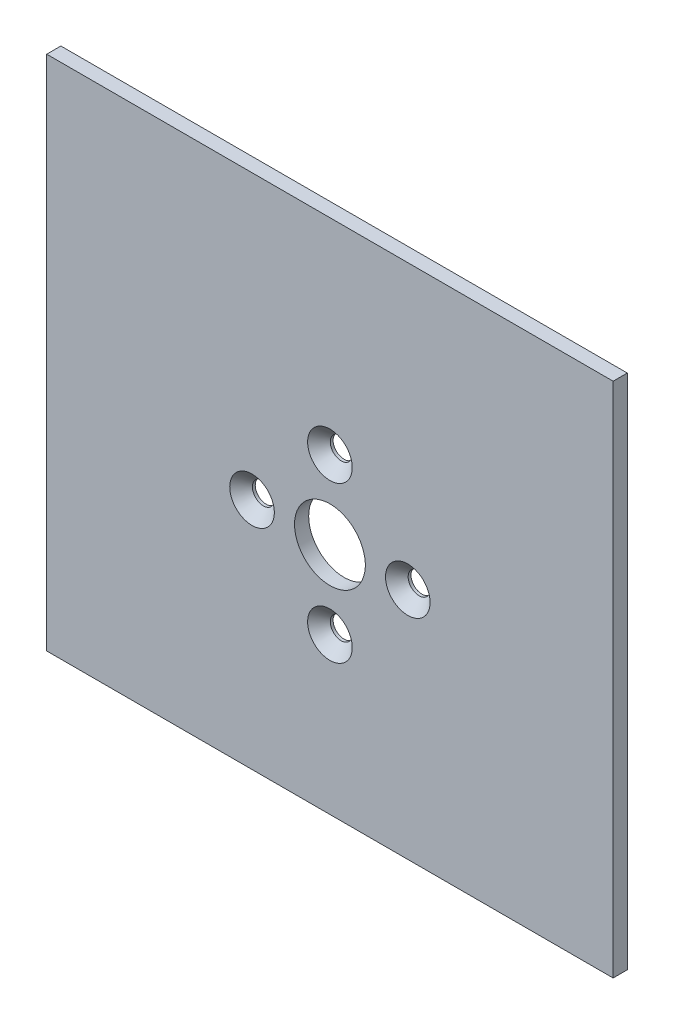
from build123d import *

# Parameters (mm, degrees)
SKETCH_1_W               = 80
SKETCH_1_H               = 73
SKETCH_1_R               = 5
EXTRUDE_1_DEPTH          = 2
PATTERN_CIRCULAR_1_COUNT = 4


with BuildPart() as part:
    # 草图1 → 凸台-拉伸1 (new body)
    with BuildSketch(Plane(origin=(0, 0, -1.3), x_dir=(-1, 0, 0), z_dir=(0, 0, -1))):
        with Locations((0, 3.5)):
            Rectangle(SKETCH_1_W, SKETCH_1_H)
        Circle(SKETCH_1_R, mode=Mode.SUBTRACT)
    extrude(amount=EXTRUDE_1_DEPTH)

    # 草图3 → 打孔尺寸(%根据十字)槽沉头自攻螺钉的类型1 (revolve, cut)
    with BuildSketch(Plane(origin=(11, 0, -1.3), x_dir=(0, -1, 0), z_dir=(1, 0, 0))):
        Polygon((0, 0), (0, 5.431333959), (1.55, 4.5), (1.55, 1.6), (3.15, 0), align=None)
    hole_wizard_1 = revolve(axis=Axis((11, 0, 5.05), (0, 0, -1)), mode=Mode.SUBTRACT)

    # 阵列(圆周)1: 打孔尺寸(%根据十字)槽沉头自攻螺钉的类型1 ×4 about axis
    pattern_circular_1_axis = Axis((0, 0, -3.3), (0, 0, -1))
    for i in range(1, PATTERN_CIRCULAR_1_COUNT):
        add(hole_wizard_1.rotate(pattern_circular_1_axis, i * 360 / PATTERN_CIRCULAR_1_COUNT), mode=Mode.SUBTRACT)


solid = part.part
